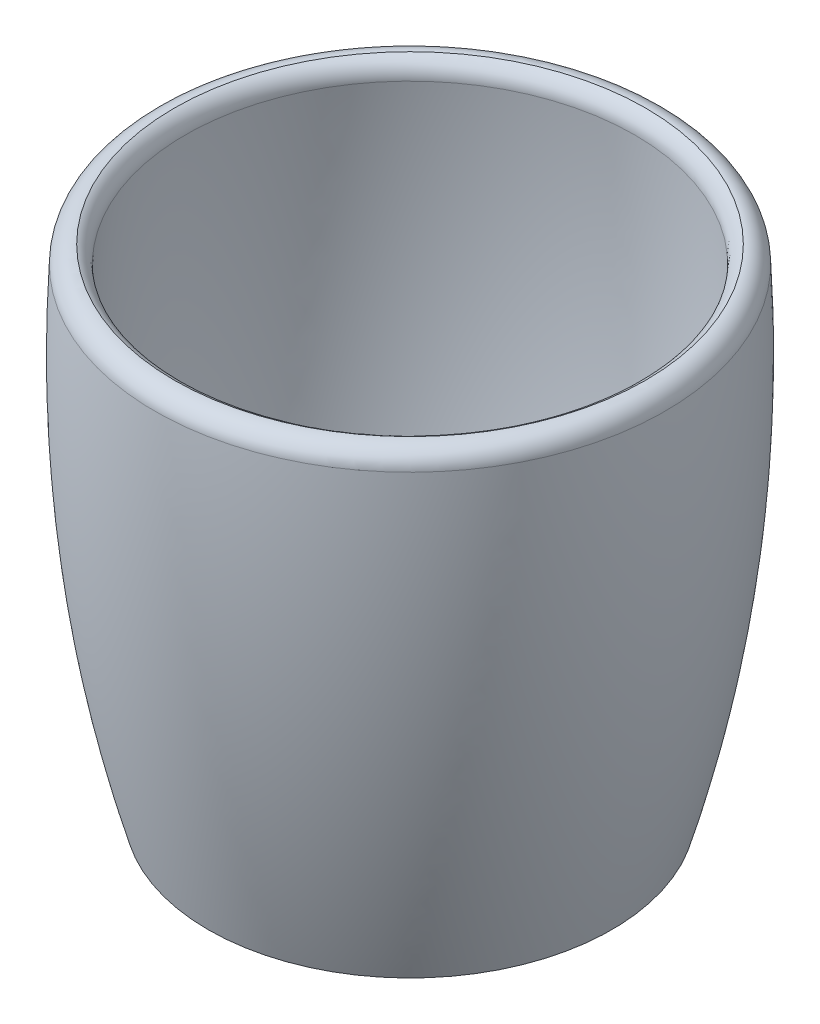
from build123d import *

# Parameters (mm, degrees)
REVOLVE_THIN1_OUTLINE_W   = 29.450267211
REVOLVE_THIN1_OUTLINE_H   = 5
REVOLVE_THIN1_OUTLINE_W_2 = 3.799732789
FILLET1_R                 = 3
FILLET2_R                 = 3


with BuildPart() as part:
    # Revolve-Thin1: read off the stored shape, not the designer's step
    # Revolve-Thin1 outline → Revolve-Thin1 (revolve)
    with BuildSketch(Plane.XY):
        with Locations((14.725133606, 2.5)):
            Rectangle(REVOLVE_THIN1_OUTLINE_W, REVOLVE_THIN1_OUTLINE_H)
        with BuildLine():
            add(Edge.make_bspline(
                [(33.25, 21.540462794), (32.189733803, 15.987039243), (30.923436105, 10.473906002), (29.450267211, 5)],
                knots=[0.776958098, 0.776958098, 0.776958098, 0.776958098, 1, 1, 1, 1], degree=3))
            Line((29.450267211, 5), (33.25, 5))
            Line((33.25, 5), (33.25, 21.540462794))
        make_face()
        with Locations((31.350133606, 2.5)):
            Rectangle(REVOLVE_THIN1_OUTLINE_W_2, REVOLVE_THIN1_OUTLINE_H)
        with BuildLine():
            add(Edge.make_bspline(
                [(36.859842979, 49.97897652), (36.696432633, 47.449856459), (36.492584883, 44.929039429), (35.565452083, 35.394305381), (34.566565666, 28.436322344), (33.25, 21.540462794)],
                knots=[0.400901641, 0.400901641, 0.400901641, 0.400901641, 0.5, 0.5, 0.776958098, 0.776958098, 0.776958098, 0.776958098], degree=3))
            Line((33.25, 21.540462794), (33.25, 5))
            Line((33.25, 5), (34.624179934, 5))
            add(Edge.make_bspline(
                [(36.859842979, 14.264797136), (36.178275367, 11.164191598), (35.433094422, 8.075928422), (34.624179934, 5)],
                knots=[0.81982334, 0.81982334, 0.81982334, 0.81982334, 0.936591868, 0.936591868, 0.936591868, 0.936591868], degree=3))
            Line((36.859842979, 14.264797136), (36.859842979, 49.97897652))
        make_face()
        with BuildLine():
            Line((34.624179934, 5), (33.25, 5))
            Line((33.25, 5), (33.25, 0))
            add(Edge.make_bspline(
                [(34.624179934, 5), (34.184919817, 3.329696526), (33.726866255, 1.663030265), (33.25, 0)],
                knots=[0.936591868, 0.936591868, 0.936591868, 0.936591868, 1, 1, 1, 1], degree=3))
        make_face()
        with BuildLine():
            add(Edge.make_bspline(
                [(36.859842979, 81.086419218), (37.520194687, 70.57793496), (37.520918259, 60.210512009), (36.859842979, 49.97897652)],
                knots=[0, 0, 0, 0, 0.400901641, 0.400901641, 0.400901641, 0.400901641], degree=3))
            Line((36.859842979, 49.97897652), (36.859842979, 14.264797136))
            add(Edge.make_bspline(
                [(41.85, 49.665684489), (41.076850789, 37.691576327), (39.415577842, 25.891414258), (36.859842979, 14.264797136)],
                knots=[0.381965979, 0.381965979, 0.381965979, 0.381965979, 0.81982334, 0.81982334, 0.81982334, 0.81982334], degree=3))
            Line((41.85, 49.665684489), (41.85, 81.086419218))
            Line((41.85, 81.086419218), (36.859842979, 81.086419218))
        make_face()
        Polygon((41.85, 81.4), (36.859842979, 81.086419218), (41.85, 81.086419218), align=None)
        with BuildLine():
            add(Edge.make_bspline(
                [(41.85, 81.4), (41.856569252, 81.295460437), (41.863074519, 81.19093351), (41.869515798, 81.086419218)],
                knots=[0, 0, 0, 0, 0.003728115, 0.003728115, 0.003728115, 0.003728115], degree=3))
            Line((41.85, 81.4), (41.85, 81.086419218))
            Line((41.85, 81.086419218), (41.869515798, 81.086419218))
        make_face()
        with BuildLine():
            Line((41.869515798, 81.086419218), (41.85, 81.086419218))
            Line((41.85, 81.086419218), (41.85, 49.665684489))
            add(Edge.make_bspline(
                [(42.355318185, 65.4252057), (42.355318195, 60.138951042), (42.187053846, 54.885788383), (41.85, 49.665684489)],
                knots=[0.191082375, 0.191082375, 0.191082375, 0.191082375, 0.381965979, 0.381965979, 0.381965979, 0.381965979], degree=3))
            add(Edge.make_bspline(
                [(41.869515798, 81.086419218), (42.193218531, 75.834114157), (42.355318175, 70.613720127), (42.355318185, 65.4252057)],
                knots=[0.003728115, 0.003728115, 0.003728115, 0.003728115, 0.191082375, 0.191082375, 0.191082375, 0.191082375], degree=3))
        make_face()
    revolve(axis=Axis((0, 0, 0), (0, 1, 0)))

    # Fillet1
    fillet1_edges = [part.edges().sort_by_distance(p)[0] for p in [
        (-41.85, 81.4, 0),
    ]]
    fillet(fillet1_edges, radius=FILLET1_R)

    # Fillet2
    # the kernel refuses this fillet: 3 mm, written as the material it takes off along each edge
    with BuildSketch(Plane(origin=(0, 81.086419218, 0), x_dir=(1, 0, 0), z_dir=(0, 0, 1))) as fillet2_piece_1:
        with BuildLine():
            CenterArc((40.015828759, -2.634967847), FILLET2_R, 113.107886202, 69.859477004)
            Line((37.019851206, -2.790269174), (36.959931655, -2.7933752))
            ThreePointArc((36.959931655, -2.7933752), (36.883770687, -1.398350534), (36.799961095, -0.003762969))
            Line((36.799961095, -0.003762969), (36.85608001, 0.059881884))
            ThreePointArc((36.85608001, 0.059881884), (37.845377324, 0.122049192), (38.814889784, 0.179520664))
            Line((38.814889784, 0.179520664), (38.838437607, 0.124334615))
        make_face()
    revolve(axis=Axis((0, 81.086419218, 0), (0, 1, 0)), mode=Mode.SUBTRACT)


solid = part.part
